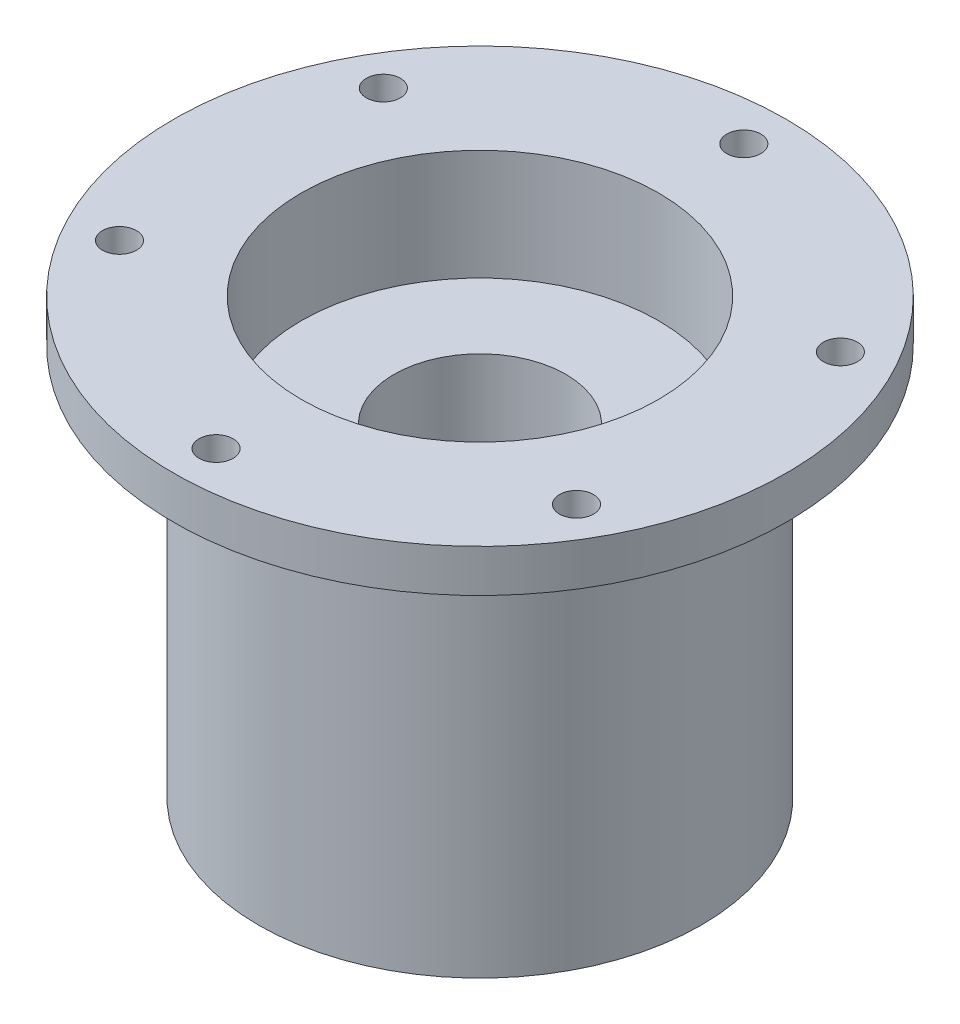
from build123d import *

# Parameters (mm, degrees)
SKETCH2_R          = 2
CUT_EXTRUDE1_DEPTH = 10
FILLET1_R          = 2


with BuildPart() as part:
    # Sketch1 → Revolve1 (revolve)
    with BuildSketch(Plane.XY):
        Polygon((21, 25.5), (21, 12.5), (10.1, 12.5), (10.1, -12.5), (21, -12.5), (21, -25.5), (26, -25.5), (26, 20.5), (36, 20.5), (36, 25.5), align=None)
    revolve(axis=Axis((0, 0, 0), (0, 1, 0)))

    # Sketch2 → Cut-Extrude1 (cut)
    with BuildSketch(Plane.XZ.offset(-20.5)):
        with Locations((0, 31)):
            Circle(SKETCH2_R)
        with Locations((26.846787517, 15.5)):
            Circle(SKETCH2_R)
        with Locations((26.846787517, -15.5)):
            Circle(SKETCH2_R)
        with Locations((0, -31)):
            Circle(SKETCH2_R)
        with Locations((-26.846787517, -15.5)):
            Circle(SKETCH2_R)
        with Locations((-26.846787517, 15.5)):
            Circle(SKETCH2_R)
    extrude(amount=-CUT_EXTRUDE1_DEPTH, mode=Mode.SUBTRACT)

    # Fillet1
    fillet1_edges = [part.edges().sort_by_distance(p)[0] for p in [
        (-26, 20.5, 0),
    ]]
    fillet(fillet1_edges, radius=FILLET1_R)


solid = part.part
